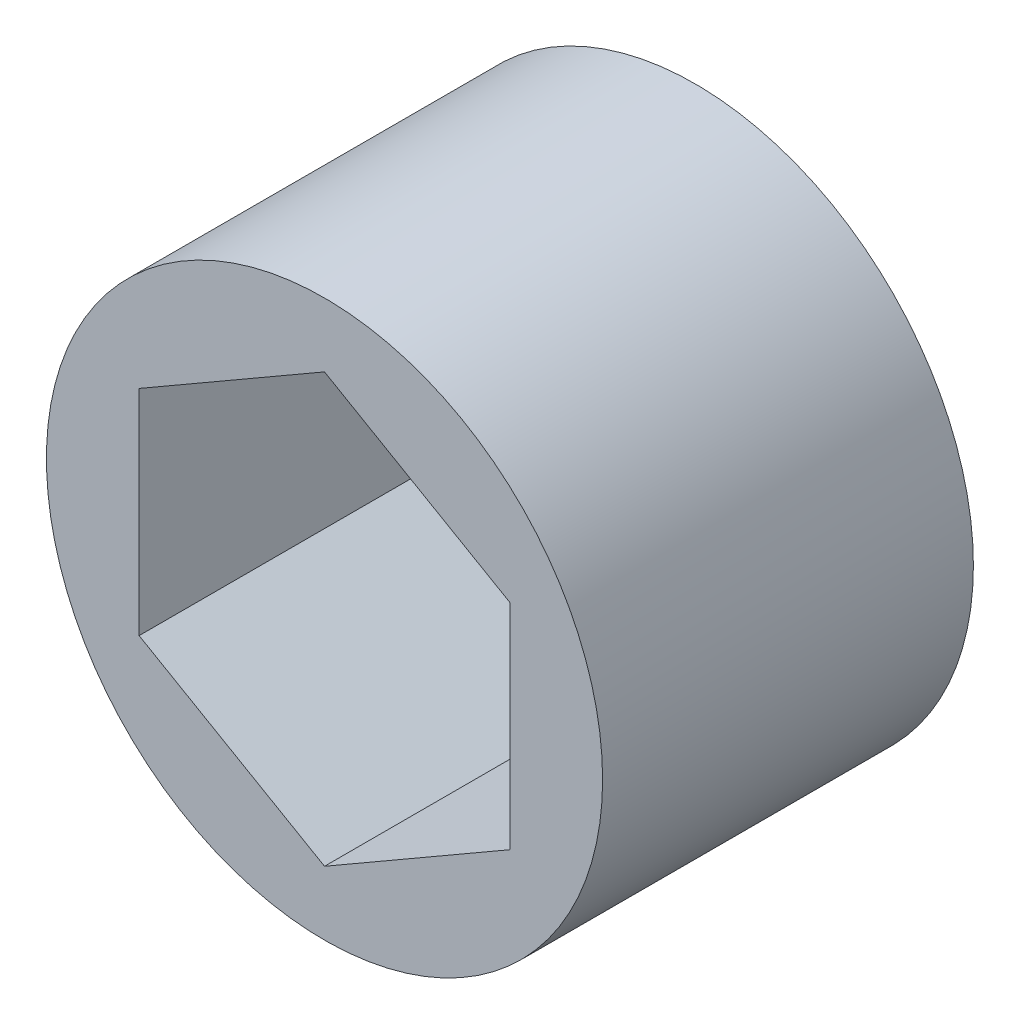
from build123d import *

# Parameters (mm, degrees)
SKETCH1_R           = 9.525
BOSS_EXTRUDE1_DEPTH = 12.7


with BuildPart() as part:
    # Sketch1 → Boss-Extrude1 (new body)
    with BuildSketch(Plane.XY):
        Circle(SKETCH1_R)
        Polygon((0, 7.332348419), (-6.35, 3.666174209), (-6.35, -3.666174209), (0, -7.332348419), (6.35, -3.666174209), (6.35, 3.666174209), align=None, mode=Mode.SUBTRACT)
    extrude(amount=BOSS_EXTRUDE1_DEPTH)


solid = part.part
